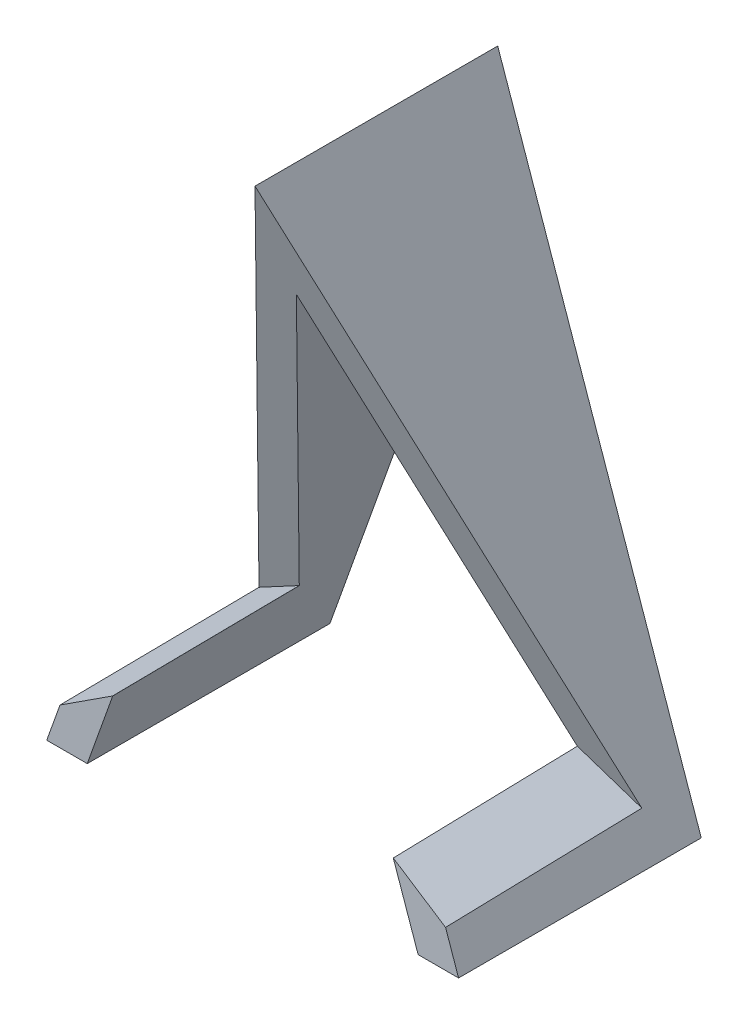
from build123d import *

# Parameters (mm, degrees)
BOSS_EXTRU_1_DEPTH      = 30
ENL_V_MAT_EXTRU_1_DEPTH = 40
CHANFREIN1_SIZE         = 5
CHANFREIN1_SIZE_2       = 4.485876758
CHANFREIN1_SIZE_3       = 4.444390394


with BuildPart() as part:
    # Esquisse1 → Boss.-Extru.1 (new body)
    with BuildSketch(Plane.XY):
        Polygon((-20.683192831, -25.589578536), (0, 32.410421464), (20.216807169, -25.589578536), (25.216807169, -25.589578536), (0.052428935, 46.604508561), (-25.692471491, -25.589578536), align=None)
    extrude(amount=BOSS_EXTRU_1_DEPTH)

    # Esquisse2 → Enlèv. mat.-Extru.1 (cut, symmetric)
    with BuildSketch(Plane(origin=(0, 0, 0), x_dir=(0, 0, -1), z_dir=(1, 0, 0))):
        Polygon((-30, 46.604508561), (-7.091444924, -16.336229224), (-30, -16.777180943), align=None)
    extrude(amount=ENL_V_MAT_EXTRU_1_DEPTH, both=True, mode=Mode.SUBTRACT)

    # Chanfrein1
    # the kernel refuses this chamfer: 5, 4.485876758, 4.444390394 mm, written as the material it takes off along each edge
    with BuildSketch(Plane(origin=(-22.303983799, -16.087550115, -5.828062673), x_dir=(0.9997543804703944, 0.020937821677919046, 0.0072654217800036), z_dir=(-0.00686265654519205, -0.019244324745599332, 0.9997912581685382))) as chanfrein1_piece_1_section:
        Polygon((CHANFREIN1_SIZE * 0.999777923546, -CHANFREIN1_SIZE * 0.0210737654663), (-CHANFREIN1_SIZE_2 * 0.35560163891, -CHANFREIN1_SIZE_2 * 0.934637616571), (0, 0), align=None)
    chanfrein1_piece_1 = extrude(amount=48.757748051, mode=Mode.PRIVATE)
    chanfrein1_piece_1 = split(chanfrein1_piece_1, bisect_by=Plane(origin=(-21.319692557, -14.185364149, 7.874295789), z_dir=(0, -0.3420201433256631, 0.9396926207859105)), keep=Keep.TOP, mode=Mode.PRIVATE)
    add(chanfrein1_piece_1, mode=Mode.SUBTRACT)
    with BuildSketch(Plane(origin=(22.231789239, -17.025860313, 42.919521162), x_dir=(0.35409216493463397, -0.9349886052835225, -0.0203726954985718), z_dir=(-0.006707917430774409, 0.01924434495210566, -0.9997923079475588))) as chanfrein1_piece_2_section:
        Polygon((CHANFREIN1_SIZE_3 * 0.999645713908, CHANFREIN1_SIZE_3 * 0.0266166655786), (-CHANFREIN1_SIZE * 0.354100131597, CHANFREIN1_SIZE * 0.935207515369), (0, 0), align=None)
    chanfrein1_piece_2 = extrude(amount=48.757723993, mode=Mode.PRIVATE)
    chanfrein1_piece_2 = split(chanfrein1_piece_2, bisect_by=Plane(origin=(20.901821142, -14.176256403, 7.877610737), z_dir=(0, -0.3420201433256631, 0.9396926207859105)), keep=Keep.TOP, mode=Mode.PRIVATE)
    add(chanfrein1_piece_2, mode=Mode.SUBTRACT)


solid = part.part
